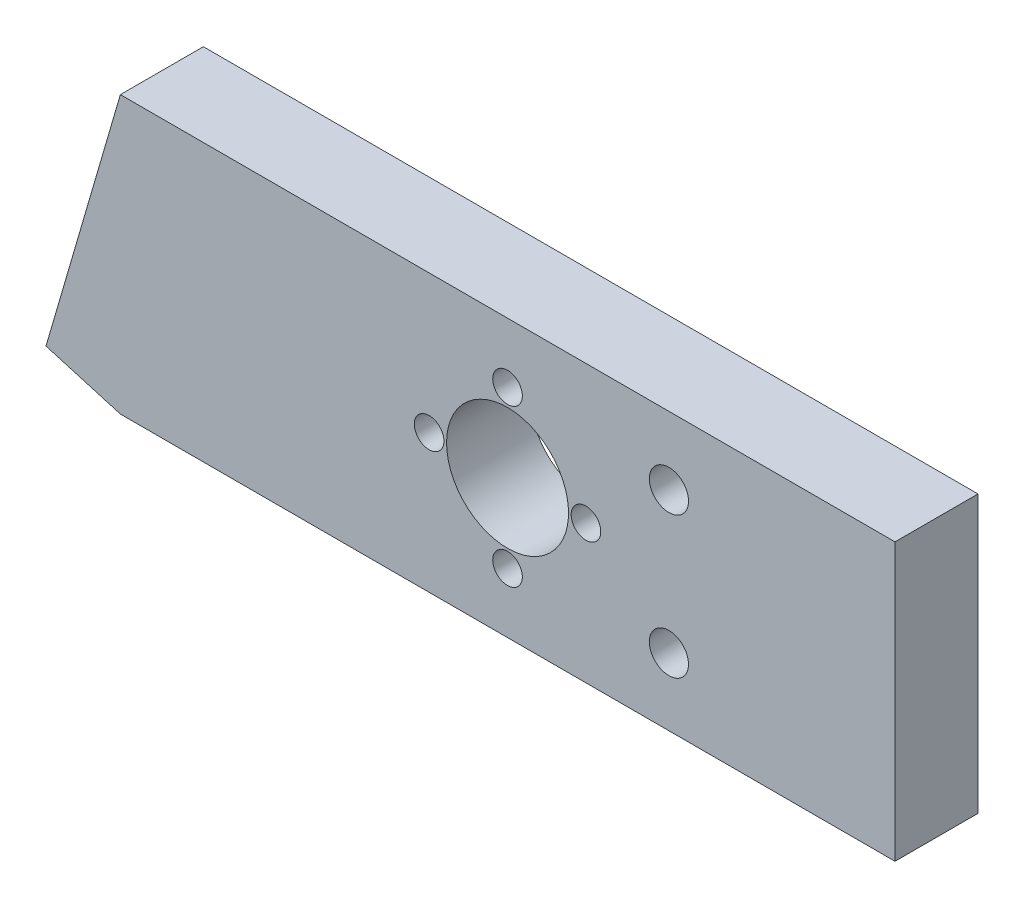
from build123d import *

# Parameters (mm, degrees)
SKETCH1_R           = 1.7
SKETCH1_R_2         = 7
SKETCH1_R_3         = 2.2479
BOSS_EXTRUDE1_DEPTH = 9.525


with BuildPart() as part:
    # Sketch1 → Boss-Extrude1 (new body)
    with BuildSketch(Plane.XY):
        Polygon((-44.432958233, 15.875), (44.467041767, 15.875), (44.467041767, -15.875), (-44.432958233, -15.875), (-52.967358233, -13.3858), align=None)
        with Locations((0, 9.000038396)):
            Circle(SKETCH1_R, mode=Mode.SUBTRACT)
        Circle(SKETCH1_R_2, mode=Mode.SUBTRACT)
        with Locations((18.521420092, 8.060647)):
            Circle(SKETCH1_R_3, mode=Mode.SUBTRACT)
        with Locations((18.521109153, -8.149574605)):
            Circle(SKETCH1_R_3, mode=Mode.SUBTRACT)
        with Locations((9.000038396, 0)):
            Circle(SKETCH1_R, mode=Mode.SUBTRACT)
        with Locations((0, -9.000038396)):
            Circle(SKETCH1_R, mode=Mode.SUBTRACT)
        with Locations((-9.000038396, 0)):
            Circle(SKETCH1_R, mode=Mode.SUBTRACT)
    extrude(amount=BOSS_EXTRUDE1_DEPTH)


solid = part.part
